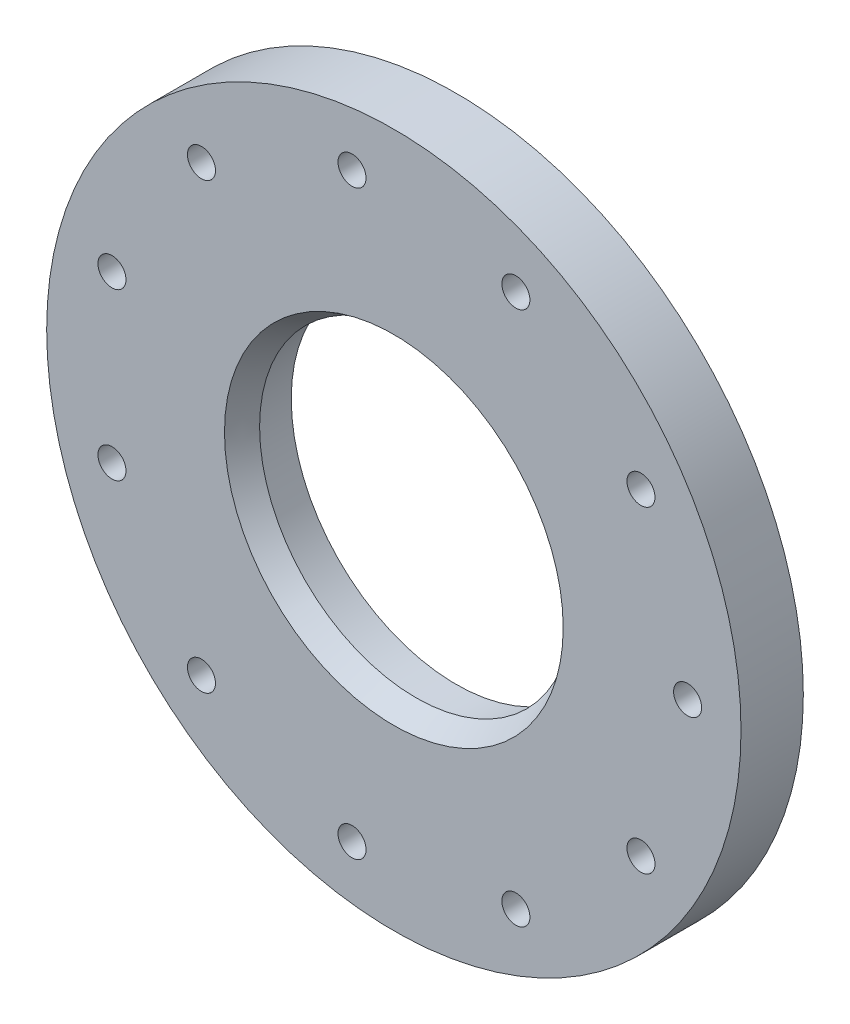
from build123d import *

# Parameters (mm, degrees)
SKETCH1_R           = 39
SKETCH1_R_2         = 2.525
SKETCH1_R_3         = 16.025
BOSS_EXTRUDE1_DEPTH = 7
SKETCH2_R           = 18.525
CUT_EXTRUDE1_DEPTH  = 4.5
SKETCH3_R           = 2.55
SKETCH3_R_2         = 1.575
BOSS_EXTRUDE2_DEPTH = 4
CHAMFER1_SIZE       = 3
CHAMFER1_SIZE_2     = 5.196152423
CHAMFER3_SIZE       = 0.5


with BuildPart() as part:
    # Sketch1 → Boss-Extrude1 (new body)
    with BuildSketch(Plane.XY.offset(15)):
        Circle(SKETCH1_R)
        with Locations((33, 0)):
            Circle(SKETCH1_R_2, mode=Mode.SUBTRACT)
        with Locations((27.761366583, -17.841146976)):
            Circle(SKETCH1_R_2, mode=Mode.SUBTRACT)
        with Locations((13.708695429, -30.017855847)):
            Circle(SKETCH1_R_2, mode=Mode.SUBTRACT)
        with Locations((-4.696389663, -32.664107582)):
            Circle(SKETCH1_R_2, mode=Mode.SUBTRACT)
        with Locations((-21.61040422, -24.939735954)):
            Circle(SKETCH1_R_2, mode=Mode.SUBTRACT)
        with Locations((-31.663268129, -9.297174376)):
            Circle(SKETCH1_R_2, mode=Mode.SUBTRACT)
        with Locations((-31.663268129, 9.297174376)):
            Circle(SKETCH1_R_2, mode=Mode.SUBTRACT)
        with Locations((-21.61040422, 24.939735954)):
            Circle(SKETCH1_R_2, mode=Mode.SUBTRACT)
        with Locations((-4.696389663, 32.664107582)):
            Circle(SKETCH1_R_2, mode=Mode.SUBTRACT)
        with Locations((13.708695429, 30.017855847)):
            Circle(SKETCH1_R_2, mode=Mode.SUBTRACT)
        with Locations((27.761366583, 17.841146976)):
            Circle(SKETCH1_R_2, mode=Mode.SUBTRACT)
        Circle(SKETCH1_R_3, mode=Mode.SUBTRACT)
    extrude(amount=BOSS_EXTRUDE1_DEPTH)

    # Sketch2 → Cut-Extrude1 (cut)
    with BuildSketch(Plane(origin=(0, 0, 15), x_dir=(-1, 0, 0), z_dir=(0, 0, -1))):
        Circle(SKETCH2_R)
    extrude(amount=-CUT_EXTRUDE1_DEPTH, mode=Mode.SUBTRACT)

    # Sketch3 → Boss-Extrude2 (add)
    # profile 1 of 11: a face of its own
    with BuildSketch(Plane.XY.offset(22)):
        with Locations((-4.696389663, 32.664107582)):
            Circle(SKETCH3_R)
        with Locations((-4.696389663, 32.664107582)):
            Circle(SKETCH3_R_2, mode=Mode.SUBTRACT)
    # profile 2 of 11: a face of its own
    with BuildSketch(Plane.XY.offset(22)):
        with Locations((13.708695429, 30.017855847)):
            Circle(SKETCH3_R)
        with Locations((13.708695429, 30.017855847)):
            Circle(SKETCH3_R_2, mode=Mode.SUBTRACT)
    # profile 3 of 11: a face of its own
    with BuildSketch(Plane.XY.offset(22)):
        with Locations((27.761366583, 17.841146976)):
            Circle(SKETCH3_R)
        with Locations((27.761366583, 17.841146976)):
            Circle(SKETCH3_R_2, mode=Mode.SUBTRACT)
    # profile 4 of 11: a face of its own
    with BuildSketch(Plane.XY.offset(22)):
        with Locations((33, 0)):
            Circle(SKETCH3_R)
        with Locations((33, 0)):
            Circle(SKETCH3_R_2, mode=Mode.SUBTRACT)
    # profile 5 of 11: a face of its own
    with BuildSketch(Plane.XY.offset(22)):
        with Locations((27.761366583, -17.841146976)):
            Circle(SKETCH3_R)
        with Locations((27.761366583, -17.841146976)):
            Circle(SKETCH3_R_2, mode=Mode.SUBTRACT)
    # profile 6 of 11: a face of its own
    with BuildSketch(Plane.XY.offset(22)):
        with Locations((13.708695429, -30.017855847)):
            Circle(SKETCH3_R)
        with Locations((13.708695429, -30.017855847)):
            Circle(SKETCH3_R_2, mode=Mode.SUBTRACT)
    # profile 7 of 11: a face of its own
    with BuildSketch(Plane.XY.offset(22)):
        with Locations((-4.696389663, -32.664107582)):
            Circle(SKETCH3_R)
        with Locations((-4.696389663, -32.664107582)):
            Circle(SKETCH3_R_2, mode=Mode.SUBTRACT)
    # profile 8 of 11: a face of its own
    with BuildSketch(Plane.XY.offset(22)):
        with Locations((-21.61040422, -24.939735954)):
            Circle(SKETCH3_R)
        with Locations((-21.61040422, -24.939735954)):
            Circle(SKETCH3_R_2, mode=Mode.SUBTRACT)
    # profile 9 of 11: a face of its own
    with BuildSketch(Plane.XY.offset(22)):
        with Locations((-31.663268129, -9.297174376)):
            Circle(SKETCH3_R)
        with Locations((-31.663268129, -9.297174376)):
            Circle(SKETCH3_R_2, mode=Mode.SUBTRACT)
    # profile 10 of 11: a face of its own
    with BuildSketch(Plane.XY.offset(22)):
        with Locations((-31.663268129, 9.297174376)):
            Circle(SKETCH3_R)
        with Locations((-31.663268129, 9.297174376)):
            Circle(SKETCH3_R_2, mode=Mode.SUBTRACT)
    # profile 11 of 11: a face of its own
    with BuildSketch(Plane.XY.offset(22)):
        with Locations((-21.61040422, 24.939735954)):
            Circle(SKETCH3_R)
        with Locations((-21.61040422, 24.939735954)):
            Circle(SKETCH3_R_2, mode=Mode.SUBTRACT)
    extrude(amount=-BOSS_EXTRUDE2_DEPTH)

    # Chamfer1
    # the kernel refuses this chamfer: 5.196152423, 3 mm, written as the material it takes off along each edge
    with BuildSketch(Plane(origin=(0, 0, 22), x_dir=(1, 0, 0), z_dir=(0, -1, 0))) as chamfer1_piece_1:
        Polygon((16.025 + CHAMFER1_SIZE, 0), (16.025, -CHAMFER1_SIZE_2), (16.025, 0), align=None)
    revolve(axis=Axis((0, 0, 22), (0, 0, 1)), mode=Mode.SUBTRACT)

    # Chamfer3
    chamfer3_edges = [part.edges().sort_by_distance(p)[0] for p in [
        (11.183695429, -30.017855847, 15),
        (-7.221389663, -32.664107582, 15),
        (-24.13540422, -24.939735954, 15),
        (-34.188268129, -9.297174376, 15),
        (-34.188268129, 9.297174376, 15),
        (-24.13540422, 24.939735954, 15),
        (-7.221389663, 32.664107582, 15),
        (11.183695429, 30.017855847, 15),
        (25.236366583, 17.841146976, 15),
        (30.475, 0, 15),
        (25.236366583, -17.841146976, 15),
    ]]
    chamfer(chamfer3_edges, length=CHAMFER3_SIZE)


solid = part.part
